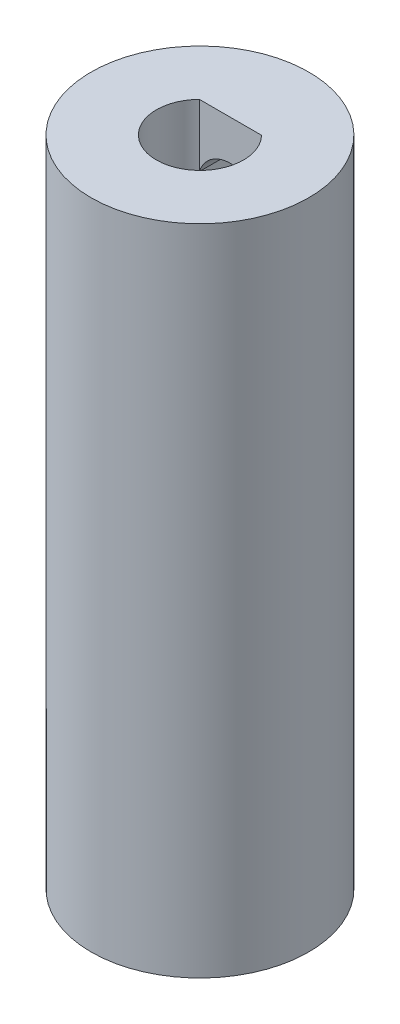
from build123d import *

# Parameters (mm, degrees)
SKETCH_2_R          = 5
EXTRUDE_2_DEPTH     = 30
CUT_EXTRUDE_1_DEPTH = 31.822070015
CUT_EXTRUDE_2_REACH = 33.08


with BuildPart() as part:
    # 草图2 → 凸台-拉伸2 (new body)
    with BuildSketch(Plane(origin=(0, 0, 0), x_dir=(1, 0, 0), z_dir=(0, 1, 0))):
        Circle(SKETCH_2_R)
    extrude(amount=EXTRUDE_2_DEPTH)

    # 草图4 → 切除-拉伸1 (cut, through all)
    with BuildSketch(Plane(origin=(0, 30, 0), x_dir=(1, 0, 0), z_dir=(0, 1, 0))):
        with BuildLine():
            Line((0, 1.4), (-1.428285686, 1.4))
            ThreePointArc((-1.428285686, 1.4), (-0.756117924, -1.851563039), (2, 0))
            ThreePointArc((2, 0), (1.851563039, 0.756117924), (1.428285686, 1.4))
            Line((1.428285686, 1.4), (0, 1.4))
        make_face()
    extrude(amount=-CUT_EXTRUDE_1_DEPTH, mode=Mode.SUBTRACT)

    # 草图5 → 切除-拉伸2 (cut, up to next)
    with BuildSketch(Plane.XY.offset(-1.4), mode=Mode.PRIVATE) as cut_extrude_2_sk1:
        with BuildLine():
            Line((1.428285686, 26.210947143), (1.428285686, 27.127462282))
            ThreePointArc((1.428285686, 27.127462282), (0.88391562, 27.881101233), (0, 28.169204712))
            ThreePointArc((0, 28.169204712), (-0.88391562, 27.881101233), (-1.428285686, 27.127462282))
            Line((-1.428285686, 27.127462282), (-1.428285686, 26.210947143))
            ThreePointArc((-1.428285686, 26.210947143), (0, 25.169204712), (1.428285686, 26.210947143))
        make_face()
    cut_extrude_2_tool1 = extrude(cut_extrude_2_sk1.sketch, amount=-CUT_EXTRUDE_2_REACH, mode=Mode.PRIVATE) & part.part
    add(cut_extrude_2_tool1.solids().sort_by_distance((0, 26.669205, -1.4))[0], mode=Mode.SUBTRACT)


solid = part.part
